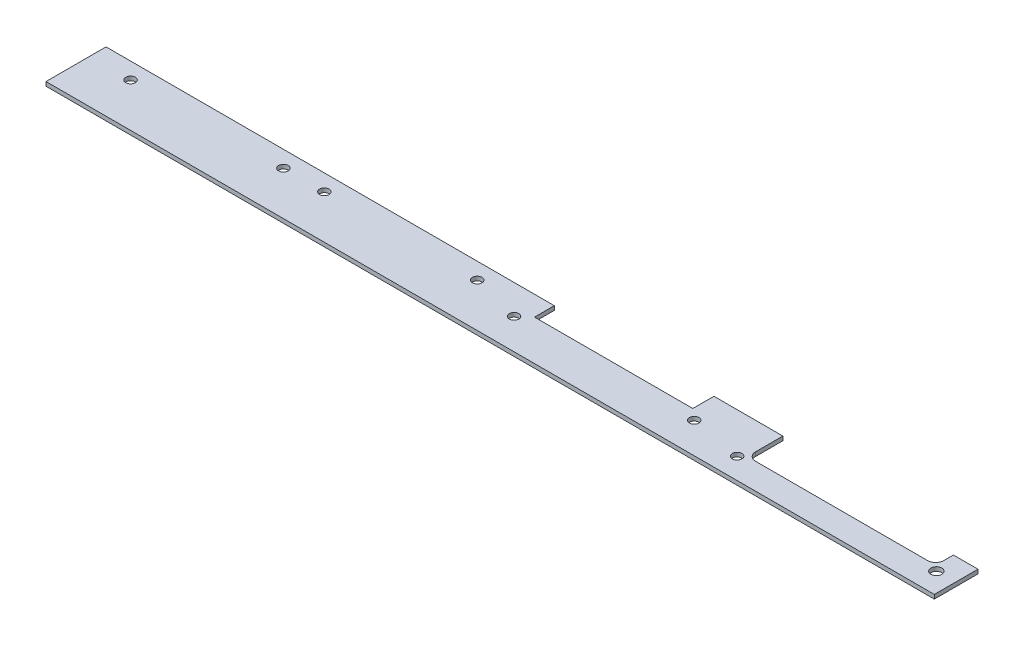
from build123d import *

# Parameters (mm, degrees)
SKETCH_1_R      = 1.75
SKETCH_1_R_2    = 2
EXTRUDE_1_DEPTH = 1.5


with BuildPart() as part:
    # Эскиз1 → Бобышка-Вытянуть1 (new body)
    with BuildSketch(Plane(origin=(0, 0, 0), x_dir=(1, 0, 0), z_dir=(0, 1, 0))):
        with BuildLine():
            Line((247.5, 22.5), (247.5, 12.5))
            ThreePointArc((247.5, 12.5), (248.378679656, 10.378679656), (250.5, 9.5))
            Line((250.5, 9.5), (313.5, 9.5))
            ThreePointArc((313.5, 9.5), (315.621320344, 10.378679656), (316.5, 12.5))
            Line((316.5, 12.5), (316.5, 16))
            Line((316.5, 16), (325.5, 16))
            Line((325.5, 16), (325.5, 0))
            Line((325.5, 0), (0, 0))
            Line((0, 0), (0, 22))
            Line((0, 22), (164.25, 22))
            Line((164.25, 22), (164.25, 14.75))
            Line((164.25, 14.75), (222.25, 14.75))
            Line((222.25, 14.75), (222.25, 22.5))
            Line((222.25, 22.5), (247.5, 22.5))
        make_face()
        with Locations((245.5, 7.75)):
            Circle(SKETCH_1_R, mode=Mode.SUBTRACT)
        with Locations((71, 16)):
            Circle(SKETCH_1_R, mode=Mode.SUBTRACT)
        with Locations((15, 16)):
            Circle(SKETCH_1_R, mode=Mode.SUBTRACT)
        with Locations((86, 16)):
            Circle(SKETCH_1_R, mode=Mode.SUBTRACT)
        with Locations((142, 16)):
            Circle(SKETCH_1_R, mode=Mode.SUBTRACT)
        with Locations((318.5, 7.75)):
            Circle(SKETCH_1_R_2, mode=Mode.SUBTRACT)
        with Locations((160.25, 11.25)):
            Circle(SKETCH_1_R, mode=Mode.SUBTRACT)
        with Locations((226.25, 11.25)):
            Circle(SKETCH_1_R, mode=Mode.SUBTRACT)
    extrude(amount=EXTRUDE_1_DEPTH)


solid = part.part
